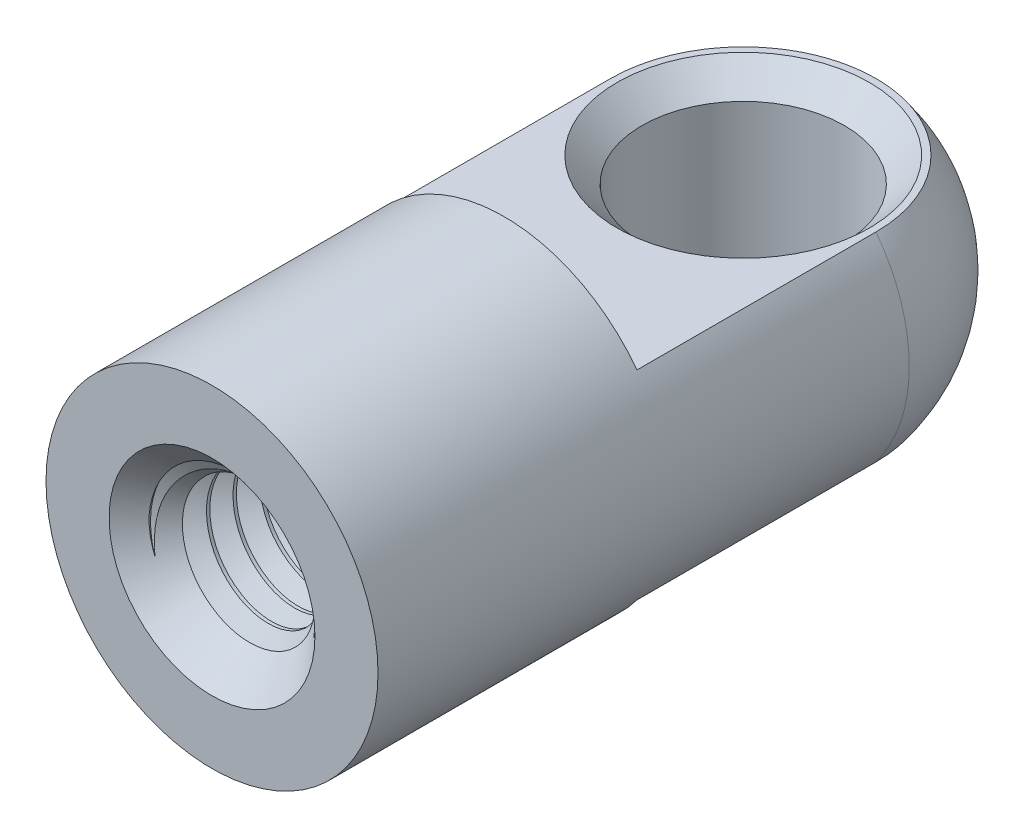
from build123d import *

# Parameters (mm, degrees)
CUT_EXTRUDE1_DEPTH           = 23.158519806
CUT_EXTRUDE1_DEPTH_BACK      = 23.158519806
CUT_EXTRUDE2_DEPTH           = 23.158519806
CUT_EXTRUDE2_DEPTH_BACK      = 23.158519806
SKETCH5_R                    = 3.05
CHAMFER1_SIZE                = 0.75
SWEEP2_PITCH                 = 0.8
SKETCH8_R                    = 3.1
CUT_EXTRUDE3_OTHER_WAY_DEPTH = 23.158519851


with BuildPart() as part:
    # Sketch3 → Revolve1 (revolve)
    with BuildSketch(Plane(origin=(0, 0, 0), x_dir=(1, 0, 0), z_dir=(0, 1, 0)), mode=Mode.PRIVATE) as revolve1_sk:
        with BuildLine():
            Line((0, 8), (-2.5, 8))
            Line((-2.5, 8), (-2.5, 0))
            Line((-2.5, 0), (-5, 0))
            Line((-5, 0), (-5, 16))
            ThreePointArc((-5, 16), (-3.535533906, 19.535533906), (0, 21))
            Line((0, 21), (0, 8))
        make_face()
    revolve(revolve1_sk.sketch.rotate(Axis((0, 0, 0), (0, 0, -1)), 180), axis=Axis((0, 0, 0), (0, 0, -1)))

    # Sketch4 → Cut-Extrude1 (cut, two sides: drawn at the far end of the back side and taken through both)
    with BuildSketch(Plane(origin=(0, 0, 0), x_dir=(0, 0, -1), z_dir=(1, 0, 0)).offset(-CUT_EXTRUDE1_DEPTH_BACK)):
        Polygon((21, 3), (8.8, 3), (8.8, 5), (8.8, 5.8), (21, 5.8), align=None)
        Polygon((21, -5.8), (21, -3), (8.8, -3), (8.8, -5), (8.8, -5.8), align=None)
    extrude(amount=CUT_EXTRUDE1_DEPTH + CUT_EXTRUDE1_DEPTH_BACK, mode=Mode.SUBTRACT)

    # Sketch5 → Cut-Extrude2 (cut, two sides: drawn at the far end of the back side and taken through both)
    with BuildSketch(Plane(origin=(0, 0, 0), x_dir=(1, 0, 0), z_dir=(0, 1, 0)).offset(-CUT_EXTRUDE2_DEPTH_BACK)):
        with Locations(Location((0, 16, 0), (0, 0, 270))):
            Circle(SKETCH5_R)
    extrude(amount=CUT_EXTRUDE2_DEPTH + CUT_EXTRUDE2_DEPTH_BACK, mode=Mode.SUBTRACT)

    # Chamfer1
    chamfer1_edges = [part.edges().sort_by_distance(p)[0] for p in [
        (0, 3, -19.05),
        (0, -3, -19.05),
    ]]
    chamfer(chamfer1_edges, length=CHAMFER1_SIZE)

    # Sweep2: the profile of Sketch7 profile screwed along a right-hand helix of 12.5 turns, 8 arcs to a turn; built about Z, then put on its axis
    sweep2_z = Axis((0, 0, 0), (0, 0, 1))
    sweep2_corners = [(1.937083488, 0, -0.425), (1.937083488, 0, -0.325), (2.5003, 0, 0.000173205), (2.5003, 0, -0.750173205)]
    with BuildLine(mode=Mode.PRIVATE) as sweep2_profile:
        Line(sweep2_corners[0], sweep2_corners[1])
        Line(sweep2_corners[1], sweep2_corners[2])
        Line(sweep2_corners[2], sweep2_corners[3])
        Line(sweep2_corners[3], sweep2_corners[0])
    sweep2_cap = Face(sweep2_profile.wire())
    sweep2_turn_angles = [0, 22.5, 45, 67.5, 90, 112.5, 135, 157.5, 180, 202.5, 225, 247.5, 270, 292.5, 315, 337.5, 360]
    sweep2_turn_weights = [1, 0.9238795325112867, 1, 0.9238795325112867, 1, 0.9238795325112867, 1, 0.9238795325112867, 1, 0.9238795325112867, 1, 0.9238795325112867, 1, 0.9238795325112867, 1, 0.9238795325112867, 1]
    sweep2_turn_rails = [Edge.make_bspline([Vector(p[0], p[1], 0).rotate(sweep2_z, sweep2_turn_angles[k]) / sweep2_turn_weights[k] + Vector(0, 0, p[2] + SWEEP2_PITCH * sweep2_turn_angles[k] / 360) for k in range(17)], [0, 0, 0, 1, 1, 2, 2, 3, 3, 4, 4, 5, 5, 6, 6, 7, 7, 8, 8, 8], 2, sweep2_turn_weights) for p in sweep2_corners]
    sweep2_turn_sides = [Face.make_surface_from_curves(sweep2_turn_rails[p[0]], sweep2_turn_rails[p[1]]) for p in [(0, 1), (1, 2), (2, 3), (3, 0)]]
    sweep2_last_angles = [4320, 4342.5, 4365, 4387.5, 4410, 4432.5, 4455, 4477.5, 4500]
    sweep2_last_weights = [1, 0.9238795325112867, 1, 0.9238795325112867, 1, 0.9238795325112867, 1, 0.9238795325112655, 1]
    sweep2_last_rails = [Edge.make_bspline([Vector(p[0], p[1], 0).rotate(sweep2_z, sweep2_last_angles[k]) / sweep2_last_weights[k] + Vector(0, 0, p[2] + SWEEP2_PITCH * sweep2_last_angles[k] / 360) for k in range(9)], [0, 0, 0, 1, 1, 2, 2, 3, 3, 4, 4, 4], 2, sweep2_last_weights) for p in sweep2_corners]
    sweep2_last_sides = [Face.make_surface_from_curves(sweep2_last_rails[p[0]], sweep2_last_rails[p[1]]) for p in [(0, 1), (1, 2), (2, 3), (3, 0)]]
    sweep2 = Plane(origin=(0, 0, 0), x_dir=(0, 1, 0), z_dir=(0, 0, -1)) * Solid(Shell([*[p.moved(Location((0, 0, SWEEP2_PITCH * i))) for i in range(12) for p in sweep2_turn_sides], *sweep2_last_sides, sweep2_cap, sweep2_cap.rotate(sweep2_z, 4500).moved(Location((0, 0, SWEEP2_PITCH * 4500 / 360)))]))
    add(sweep2)

    # Cut-Extrude3 cone 1 section (through the dimple's axis) → Cut-Extrude3 (revolve, cut)
    with BuildSketch(Plane(origin=(0, 0, 0), x_dir=(0, -1, 0), z_dir=(1, 0, 0))):
        Polygon((0, 0), (3.1, 0), (0, 3.1), align=None)
    revolve(axis=Axis((0, 0, 0), (0, 0, -1)), mode=Mode.SUBTRACT)

    # Sketch8 → Cut-Extrude3 other way (cut)
    with BuildSketch(Plane.XY):
        Circle(SKETCH8_R)
    extrude(amount=CUT_EXTRUDE3_OTHER_WAY_DEPTH, mode=Mode.SUBTRACT)


solid = part.part
